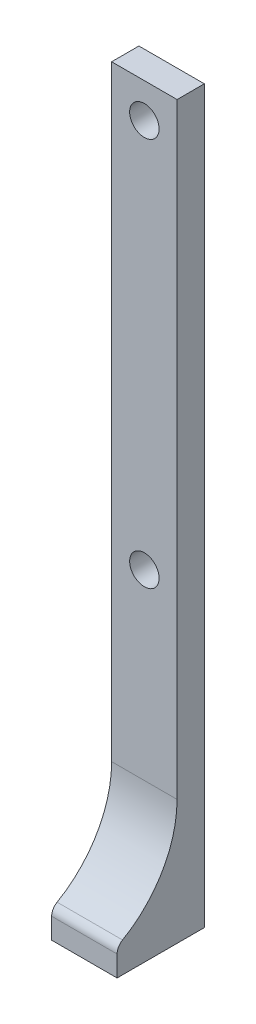
from build123d import *

# Parameters (mm, degrees)
SKICA2_W                = 6
SKICA2_H                = 42
SKICA2_R                = 1.35
SKICA2_H_2              = 25
P_IDAT_VYSUNUT_M1_DEPTH = 2.5
SKICA3_W                = 6
SKICA3_H                = 8
P_IDAT_VYSUNUT_M2_DEPTH = 2.5
ZAOBLIT1_R              = 10
ZAOBLIT2_R              = 1


with BuildPart() as part:
    # Skica2 → Přidat vysunutím1 (new body)
    # profile 1 of 2: a face of its own
    with BuildSketch(Plane.XY):
        with Locations((-3, -21)):
            Rectangle(SKICA2_W, SKICA2_H)
        with Locations((-3, -38.83625)):
            Circle(SKICA2_R, mode=Mode.SUBTRACT)
        with Locations((-3, -3.16375)):
            Circle(SKICA2_R, mode=Mode.SUBTRACT)
    # profile 2 of 2: a face of its own
    with BuildSketch(Plane.XY):
        with Locations((-3, -54.5)):
            Rectangle(SKICA2_W, SKICA2_H_2)
    extrude(amount=P_IDAT_VYSUNUT_M1_DEPTH)

    # Skica3 → Přidat vysunutím2 (add)
    with BuildSketch(Plane.XZ.offset(67)):
        with Locations((-3, 4)):
            Rectangle(SKICA3_W, SKICA3_H)
    extrude(amount=-P_IDAT_VYSUNUT_M2_DEPTH)

    # Zaoblit1
    # the kernel refuses this fillet: 10 mm, written as the material it adds along each edge
    with BuildSketch(Plane(origin=(0, -64.5, 2.5), x_dir=(0, 1, 0), z_dir=(-1, 0, 0))) as zaoblit1_piece_1:
        with BuildLine():
            CenterArc((8.93028555, -10), ZAOBLIT1_R, 90, 63.25631605)
            Line((0, -5.5), (-0.178605711, -5.41))
            ThreePointArc((-0.178605711, -5.41), (-0.2, -2.75), (-0.2, 0))
            Line((-0.2, 0), (0, 0.2))
            Line((0, 0.2), (8.93028555, 0.2))
            Line((8.93028555, 0.2), (8.93028555, 0))
        make_face()
    extrude(amount=6)

    # Zaoblit2
    zaoblit2_edges = [part.edges().sort_by_distance(p)[0] for p in [
        (-3, -64.5, 8),
    ]]
    fillet(zaoblit2_edges, radius=ZAOBLIT2_R)


solid = part.part
